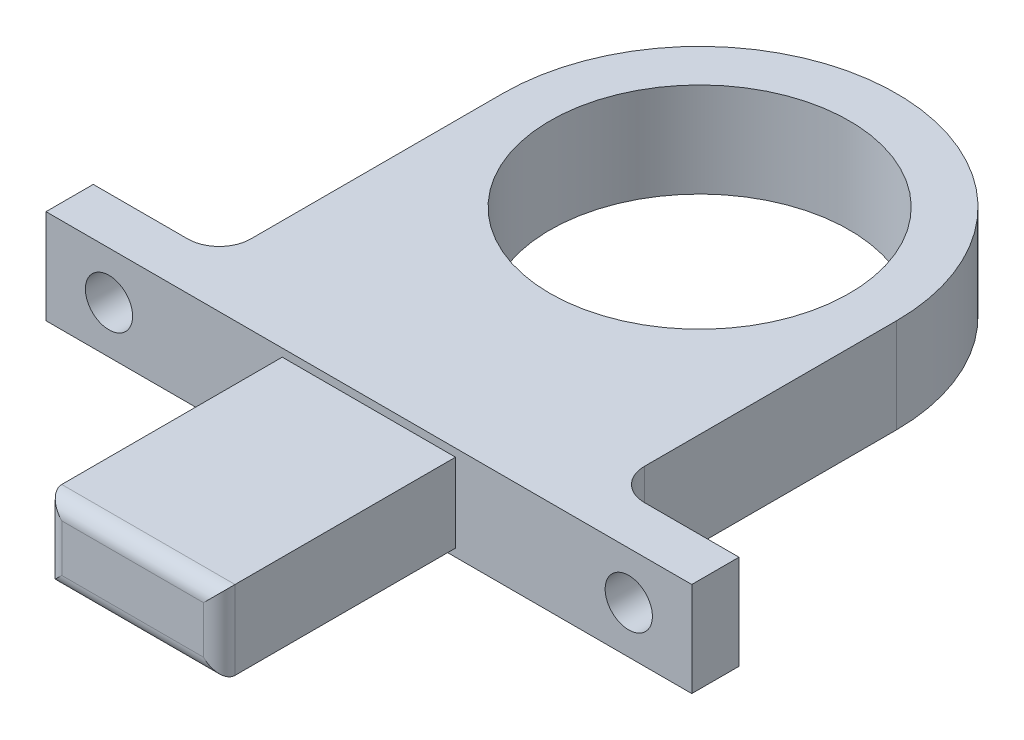
from build123d import *

# Parameters (mm, degrees)
CROQUIS1_R              = 9.5
SALIENTE_EXTRUIR1_DEPTH = 6
CROQUIS2_R              = 1.5
CORTAR_EXTRUIR1_DEPTH   = 6
CROQUIS3_R              = 3
CORTAR_EXTRUIR2_DEPTH   = 6
CROQUIS4_W              = 11
CROQUIS4_H              = 15
CORTAR_EXTRUIR3_DEPTH   = 0.5
CROQUIS5_W              = 11
CROQUIS5_H              = 15
CORTAR_EXTRUIR4_DEPTH   = 0.5
REDONDEO1_R             = 1


with BuildPart() as part:
    # Croquis1 → Saliente-Extruir1 (new body)
    with BuildSketch(Plane(origin=(0, 0, 0), x_dir=(1, 0, 0), z_dir=(0, 1, 0))):
        with BuildLine():
            ThreePointArc((12.5, 0), (0, 12.5), (-12.5, 0))
            Line((-12.5, 0), (-12.5, -16))
            ThreePointArc((-12.5, -16), (-13.085786438, -17.414213562), (-14.5, -18))
            Line((-14.5, -18), (-20.5, -18))
            Line((-20.5, -18), (-20.5, -21))
            Line((-20.5, -21), (-5.5, -21))
            Line((-5.5, -21), (-5.5, -36))
            Line((-5.5, -36), (5.5, -36))
            Line((5.5, -36), (5.5, -21))
            Line((5.5, -21), (20.5, -21))
            Line((20.5, -21), (20.5, -18))
            Line((20.5, -18), (14.5, -18))
            ThreePointArc((14.5, -18), (13.085786438, -17.414213562), (12.5, -16))
            Line((12.5, -16), (12.5, 0))
        make_face()
        Circle(CROQUIS1_R, mode=Mode.SUBTRACT)
    extrude(amount=SALIENTE_EXTRUIR1_DEPTH)

    # Croquis2 → Cortar-Extruir1 (cut)
    with BuildSketch(Plane.XY.offset(21)):
        with Locations((-16.5, 3)):
            Circle(CROQUIS2_R)
        with Locations((16.5, 3)):
            Circle(CROQUIS2_R)
    extrude(amount=-CORTAR_EXTRUIR1_DEPTH, mode=Mode.SUBTRACT)

    # Croquis3 → Cortar-Extruir2 (cut)
    with BuildSketch(Plane(origin=(0, 0, 18), x_dir=(-1, 0, 0), z_dir=(0, 0, -1))):
        with Locations((-16.5, 3)):
            Circle(CROQUIS3_R)
        with Locations((16.5, 3)):
            Circle(CROQUIS3_R)
    extrude(amount=CORTAR_EXTRUIR2_DEPTH, mode=Mode.SUBTRACT)

    # Croquis4 → Cortar-Extruir3 (cut)
    with BuildSketch(Plane.XZ):
        with Locations((0, 28.5)):
            Rectangle(CROQUIS4_W, CROQUIS4_H)
    extrude(amount=-CORTAR_EXTRUIR3_DEPTH, mode=Mode.SUBTRACT)

    # Croquis5 → Cortar-Extruir4 (cut)
    with BuildSketch(Plane(origin=(0, 6, 0), x_dir=(1, 0, 0), z_dir=(0, 1, 0))):
        with Locations((0, -28.5)):
            Rectangle(CROQUIS5_W, CROQUIS5_H)
    extrude(amount=-CORTAR_EXTRUIR4_DEPTH, mode=Mode.SUBTRACT)

    # Redondeo1
    redondeo1_edges = [part.edges().sort_by_distance(p)[0] for p in [
        (5.5, 3, 36),
        (0, 0.5, 36),
        (-5.5, 3, 36),
        (0, 5.5, 36),
    ]]
    fillet(redondeo1_edges, radius=REDONDEO1_R)


solid = part.part
